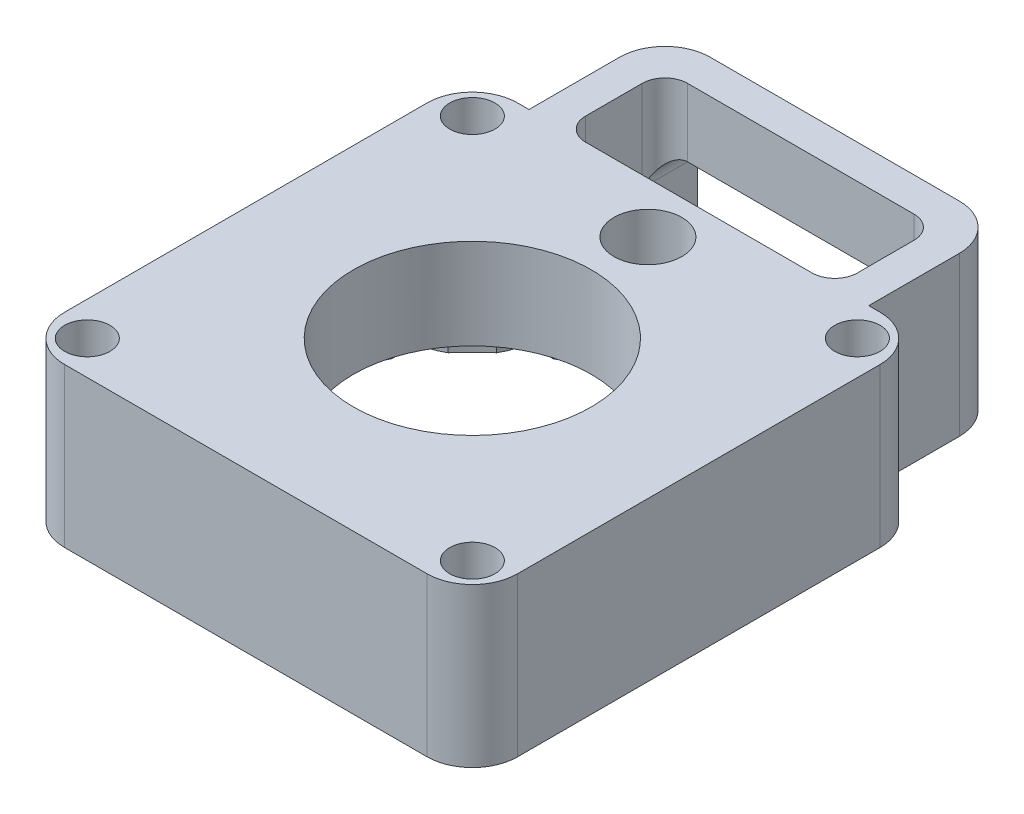
from build123d import *

# Parameters (mm, degrees)
BOSS_EXTRUDE1_DEPTH = 12
SKETCH2_R           = 1
CUT_EXTRUDE1_DEPTH  = 15
SKETCH4_R           = 2.25
CUT_EXTRUDE3_DEPTH  = 5
SHELL1_DEPTH        = 10
SHELL1_2_DEPTH      = 5
SKETCH3_R           = 9.15
CUT_EXTRUDE2_DEPTH  = 3
FILLET1_R           = 2
BOSS_EXTRUDE2_DEPTH = 7
SKETCH7_W           = 12
SKETCH7_H           = 4.549017994
CUT_EXTRUDE4_DEPTH  = 4
SKETCH8_W           = 27.297760414
SKETCH8_H           = 10.352522689
CUT_EXTRUDE5_DEPTH  = 33
BOSS_EXTRUDE8_DEPTH = 4
SKETCH11_R          = 5.5
CUT_EXTRUDE6_DEPTH  = 4
SKETCH12_R          = 1.5
CUT_EXTRUDE7_DEPTH  = 3
SKETCH13_W          = 0.4
SKETCH13_H          = 1
CUT_EXTRUDE8_DEPTH  = 5
CUT_EXTRUDE9_DEPTH  = 15
FILLET2_R           = 1
BOSS_EXTRUDE9_DEPTH = 4
SKETCH16_R          = 5.25
CUT_EXTRUDE10_DEPTH = 5.1


# Read off the part's stored shape, not the designer's step: Shell1
with BuildPart() as part:
    # Sketch1 → Boss-Extrude1 (new body)
    with BuildSketch(Plane(origin=(0, 0, 0), x_dir=(1, 0, 0), z_dir=(0, 1, 0))):
        with BuildLine():
            Line((-8, 10), (8, 10))
            ThreePointArc((8, 10), (9.414213562, 9.414213562), (10, 8))
            Line((10, 8), (10, -8))
            ThreePointArc((10, -8), (9.414213562, -9.414213562), (8, -10))
            Line((8, -10), (-8, -10))
            ThreePointArc((-8, -10), (-9.414213562, -9.414213562), (-10, -8))
            Line((-10, -8), (-10, 8))
            ThreePointArc((-10, 8), (-9.414213562, 9.414213562), (-8, 10))
        make_face()
    extrude(amount=BOSS_EXTRUDE1_DEPTH)

    # Sketch2 → Cut-Extrude1 (cut)
    with BuildSketch(Plane.XZ):
        with Locations(Location((-8.5, 8.5, 0), (0, 0, 270))):
            Circle(SKETCH2_R)
        with Locations(Location((8.5, 8.5, 0), (0, 0, 270))):
            Circle(SKETCH2_R)
        with Locations(Location((8.5, -8.5, 0), (0, 0, 270))):
            Circle(SKETCH2_R)
        with Locations(Location((-8.5, -8.5, 0), (0, 0, 270))):
            Circle(SKETCH2_R)
    extrude(amount=-CUT_EXTRUDE1_DEPTH, mode=Mode.SUBTRACT)

    # Sketch4 → Cut-Extrude3 (cut)
    with BuildSketch(Plane(origin=(0, 12, 0), x_dir=(1, 0, 0), z_dir=(0, 1, 0))):
        with Locations((8.5, -8.5)):
            Circle(SKETCH4_R)
        with Locations((-8.5, -8.5)):
            Circle(SKETCH4_R)
        with Locations((-8.5, 8.5)):
            Circle(SKETCH4_R)
        with Locations((8.5, 8.5)):
            Circle(SKETCH4_R)
    extrude(amount=-CUT_EXTRUDE3_DEPTH, mode=Mode.SUBTRACT)

    # Shell1 outline → Shell1 (cut)
    with BuildSketch(Plane(origin=(0, 0, 0), x_dir=(1, 0, 0), z_dir=(0, 1, 0))):
        with BuildLine():
            Line((-4.279514246, -8), (4.279514246, -8))
            ThreePointArc((4.279514246, -8), (5.49479618, -5.49479618), (8, -4.279514246))
            Line((8, -4.279514246), (8, 4.279514246))
            ThreePointArc((8, 4.279514246), (5.49479618, 5.49479618), (4.279514246, 8))
            Line((4.279514246, 8), (-4.279514246, 8))
            ThreePointArc((-4.279514246, 8), (-5.49479618, 5.49479618), (-8, 4.279514246))
            Line((-8, 4.279514246), (-8, -4.279514246))
            ThreePointArc((-8, -4.279514246), (-5.49479618, -5.49479618), (-4.279514246, -8))
        make_face()
    extrude(amount=SHELL1_DEPTH, mode=Mode.SUBTRACT)

    # Shell1 2 outline → Shell1 2 (cut)
    with BuildSketch(Plane(origin=(0, 0, 0), x_dir=(1, 0, 0), z_dir=(0, 1, 0))):
        with BuildLine():
            Line((4.279514246, -8), (5.541960108, -8))
            ThreePointArc((5.541960108, -8), (6.378679656, -6.378679656), (8, -5.541960108))
            Line((8, -5.541960108), (8, -4.279514246))
            ThreePointArc((8, -4.279514246), (5.49479618, -5.49479618), (4.279514246, -8))
        make_face()
        with BuildLine():
            Line((-5.541960108, -8), (-4.279514246, -8))
            ThreePointArc((-4.279514246, -8), (-5.49479618, -5.49479618), (-8, -4.279514246))
            Line((-8, -4.279514246), (-8, -5.541960108))
            ThreePointArc((-8, -5.541960108), (-6.378679656, -6.378679656), (-5.541960108, -8))
        make_face()
        with BuildLine():
            ThreePointArc((4.279514246, 8), (5.49479618, 5.49479618), (8, 4.279514246))
            Line((8, 4.279514246), (8, 5.541960108))
            ThreePointArc((8, 5.541960108), (6.378679656, 6.378679656), (5.541960108, 8))
            Line((5.541960108, 8), (4.279514246, 8))
        make_face()
        with BuildLine():
            Line((-8, 5.541960108), (-8, 4.279514246))
            ThreePointArc((-8, 4.279514246), (-5.49479618, 5.49479618), (-4.279514246, 8))
            Line((-4.279514246, 8), (-5.541960108, 8))
            ThreePointArc((-5.541960108, 8), (-6.378679656, 6.378679656), (-8, 5.541960108))
        make_face()
    extrude(amount=SHELL1_2_DEPTH, mode=Mode.SUBTRACT)

    # Sketch3 → Cut-Extrude2 (cut)
    with BuildSketch(Plane.XZ):
        Circle(SKETCH3_R)
    extrude(amount=-CUT_EXTRUDE2_DEPTH, mode=Mode.SUBTRACT)

    # Fillet1
    fillet1_edges = [part.edges().sort_by_distance(p)[0] for p in [
        (6.822949017, 9.5, -10),
        (10, 9.5, -6.822949017),
        (-6.822949017, 9.5, -10),
        (-10, 9.5, -6.822949017),
        (-10, 9.5, 6.822949017),
        (-6.822949017, 9.5, 10),
        (6.822949017, 9.5, 10),
        (10, 9.5, 6.822949017),
    ]]
    fillet(fillet1_edges, radius=FILLET1_R)

    # Sketch6 → Boss-Extrude2 (add)
    with BuildSketch(Plane.XZ):
        with BuildLine():
            Line((-7.5, -10), (7.5, -10))
            Line((7.5, -10), (7.5, -14))
            ThreePointArc((7.5, -14), (6.914213562, -15.414213562), (5.5, -16))
            Line((5.5, -16), (-5.5, -16))
            ThreePointArc((-5.5, -16), (-6.914213562, -15.414213562), (-7.5, -14))
            Line((-7.5, -14), (-7.5, -10))
        make_face()
    extrude(amount=-BOSS_EXTRUDE2_DEPTH)

    # Sketch7 → Cut-Extrude4 (cut)
    with BuildSketch(Plane.XZ):
        with Locations((0, -13.725491003)):
            Rectangle(SKETCH7_W, SKETCH7_H)
    extrude(amount=-CUT_EXTRUDE4_DEPTH, mode=Mode.SUBTRACT)

    # Sketch8 → Cut-Extrude5 (cut)
    with BuildSketch(Plane(origin=(10, 0, 0), x_dir=(0, 0, -1), z_dir=(1, 0, 0))):
        with Locations((3.648880207, 12.176261345)):
            Rectangle(SKETCH8_W, SKETCH8_H)
    extrude(amount=-CUT_EXTRUDE5_DEPTH, mode=Mode.SUBTRACT)

    # Sketch10 → Boss-Extrude8 (add)
    with BuildSketch(Plane(origin=(0, 7, 0), x_dir=(1, 0, 0), z_dir=(0, 1, 0))):
        Polygon((9.294915126, 4.441002139), (-9.072540785, 4.441002139), (-5.843708737, 9.485613806), (6.066083078, 9.485613806), align=None)
    extrude(amount=-BOSS_EXTRUDE8_DEPTH)

    # Sketch11 → Cut-Extrude6 (cut)
    with BuildSketch(Plane.XZ.offset(-3)):
        Circle(SKETCH11_R)
    extrude(amount=-CUT_EXTRUDE6_DEPTH, mode=Mode.SUBTRACT)

    # Sketch12 → Cut-Extrude7 (cut)
    with BuildSketch(Plane(origin=(0, 7, 0), x_dir=(1, 0, 0), z_dir=(0, 1, 0))):
        with Locations(Location((0, 7.75, 0), (0, 0, 270))):
            Circle(SKETCH12_R)
    extrude(amount=-CUT_EXTRUDE7_DEPTH, mode=Mode.SUBTRACT)

    # Sketch13 → Cut-Extrude8 (cut)
    with BuildSketch(Plane(origin=(0, 4, 0), x_dir=(1, 0, 0), z_dir=(0, 1, 0))):
        with Locations((0, 7.75)):
            Rectangle(SKETCH13_W, SKETCH13_H)
    extrude(amount=-CUT_EXTRUDE8_DEPTH, mode=Mode.SUBTRACT)

    # Sketch14 → Cut-Extrude9 (cut)
    with BuildSketch(Plane(origin=(0, 7, 0), x_dir=(1, 0, 0), z_dir=(0, 1, 0))):
        with BuildLine():
            Line((-5, 14.5), (5, 14.5))
            ThreePointArc((5, 14.5), (5.707106781, 14.207106781), (6, 13.5))
            Line((6, 13.5), (6, 11))
            ThreePointArc((6, 11), (5.707106781, 10.292893219), (5, 10))
            Line((5, 10), (-5, 10))
            ThreePointArc((-5, 10), (-5.707106781, 10.292893219), (-6, 11))
            Line((-6, 11), (-6, 13.5))
            ThreePointArc((-6, 13.5), (-5.707106781, 14.207106781), (-5, 14.5))
        make_face()
    extrude(amount=-CUT_EXTRUDE9_DEPTH, mode=Mode.SUBTRACT)

    # Fillet2
    fillet2_edges = [part.edges().sort_by_distance(p)[0] for p in [
        (-6, 4, -14.718245837),
        (6, 4, -14.718245837),
    ]]
    fillet(fillet2_edges, radius=FILLET2_R)

    # Sketch15 → Boss-Extrude9 (add)
    with BuildSketch(Plane(origin=(0, 7, 0), x_dir=(1, 0, 0), z_dir=(0, 1, 0))):
        Polygon((4.927887467, -8.83937155), (8.987059624, -4.361499915), (8.535312268, 4.849371277), (4.119785389, 6.639048991), (-3.498767695, 5.109974325), (-8.089855619, 5.874511658), (-8.702967098, -5.068680896), (-4.41401834, -8.956595244), align=None)
    extrude(amount=-BOSS_EXTRUDE9_DEPTH)

    # Sketch16 → Cut-Extrude10 (cut)
    with BuildSketch(Plane(origin=(0, 7, 0), x_dir=(1, 0, 0), z_dir=(0, 1, 0))):
        with Locations(Location((0, 0, 0), (0, 0, 270))):
            Circle(SKETCH16_R)
    extrude(amount=-CUT_EXTRUDE10_DEPTH, mode=Mode.SUBTRACT)


solid = part.part
